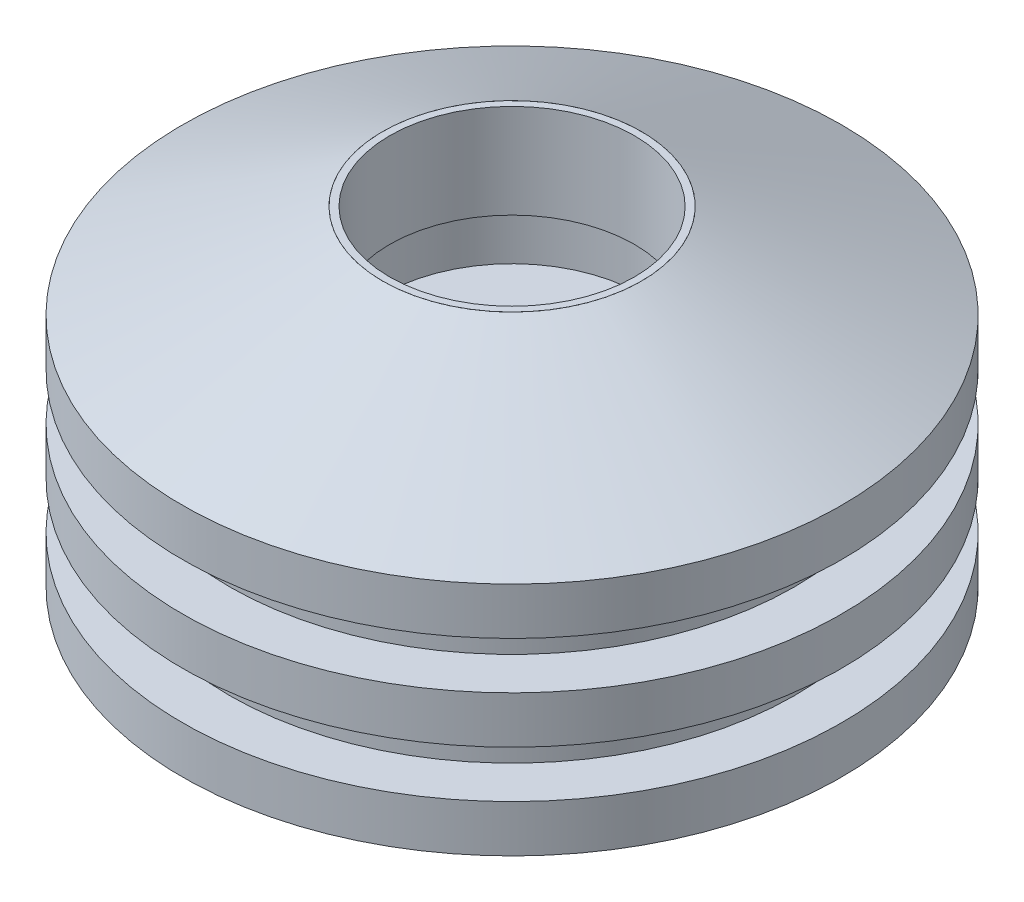
from build123d import *

# Parameters (mm, degrees)
BOSS_EXTRUDE1_START             = 3.175
SKETCH2_R                       = 22.225
SKETCH2_R_2                     = 8.73125
BOSS_EXTRUDE1_DEPTH             = 3.175
SKETCH3_R                       = 19.05
BOSS_EXTRUDE2_DEPTH             = 3.175
BOSS_EXTRUDE3_START             = 3.175
SKETCH4_R                       = 22.225
BOSS_EXTRUDE3_DEPTH             = 3.175
SKETCH5_R                       = 19.05
BOSS_EXTRUDE4_DEPTH             = 3.175
BOSS_EXTRUDE5_START             = 3.175
SKETCH6_R                       = 22.225
BOSS_EXTRUDE5_DEPTH             = 3.175
SKETCH7_R                       = 8.73125
BOSS_EXTRUDE6_DEPTH             = 6.35
SKETCH10_R                      = 8.255
CUT_EXTRUDE1_DEPTH              = 9.525
F_1_4_28_START                  = -15.875
F_1_4_28_TAPPED_HOLE1_OUTLINE_R = 2.7051
F_1_4_28_TAPPED_HOLE1_DEPTH     = 12.7


# Read off the part's stored shape, not the designer's step: 1/4-28 Tapped Hole1
with BuildPart() as part:
    # Sketch1 → Revolve1 (revolve)
    with BuildSketch(Plane.XY, mode=Mode.PRIVATE) as revolve1_sk:
        Polygon((8.73125, 0), (22.225, 0), (8.73125, 6.35), align=None)
    revolve(revolve1_sk.sketch.rotate(Axis((0, 0, 0), (0, 1, 0)), 90), axis=Axis((0, 0, 0), (0, 1, 0)))

    # Sketch2 → Boss-Extrude1 (add)
    with BuildSketch(Plane.XZ.offset(BOSS_EXTRUDE1_START)):
        with Locations(Location((0, 0, 0), (0, 0, 270))):
            Circle(SKETCH2_R)
        with Locations(Location((0, 0, 0), (0, 0, 270))):
            Circle(SKETCH2_R_2, mode=Mode.SUBTRACT)
    extrude(amount=-BOSS_EXTRUDE1_DEPTH)

    # Sketch3 → Boss-Extrude2 (add)
    with BuildSketch(Plane.XZ.offset(3.175)):
        with Locations(Location((0, 0, 0), (0, 0, 270))):
            Circle(SKETCH3_R)
    extrude(amount=BOSS_EXTRUDE2_DEPTH)

    # Sketch4 → Boss-Extrude3 (add)
    with BuildSketch(Plane.XZ.offset(6.35).offset(BOSS_EXTRUDE3_START)):
        with Locations(Location((0, 0, 0), (0, 0, 270))):
            Circle(SKETCH4_R)
    extrude(amount=-BOSS_EXTRUDE3_DEPTH)

    # Sketch5 → Boss-Extrude4 (add)
    with BuildSketch(Plane.XZ.offset(9.525)):
        with Locations(Location((0, 0, 0), (0, 0, 270))):
            Circle(SKETCH5_R)
    extrude(amount=BOSS_EXTRUDE4_DEPTH)

    # Sketch6 → Boss-Extrude5 (add)
    with BuildSketch(Plane.XZ.offset(12.7).offset(BOSS_EXTRUDE5_START)):
        with Locations(Location((0, 0, 0), (0, 0, 270))):
            Circle(SKETCH6_R)
    extrude(amount=-BOSS_EXTRUDE5_DEPTH)

    # 1/4-28 Tapped Hole1 outline → 1/4-28 Tapped Hole1 (cut)
    with BuildSketch(Plane(origin=(0, 0, 0), x_dir=(1, 0, 0), z_dir=(0, 1, 0)).offset(F_1_4_28_START)):
        Circle(F_1_4_28_TAPPED_HOLE1_OUTLINE_R)
    extrude(amount=F_1_4_28_TAPPED_HOLE1_DEPTH, mode=Mode.SUBTRACT)


with BuildPart() as body_2:
    # Sketch7 → Boss-Extrude6 (new body)
    with BuildSketch(Plane(origin=(0, 6.35, 0), x_dir=(1, 0, 0), z_dir=(0, 1, 0))):
        with Locations(Location((0, 0, 0), (0, 0, 270))):
            Circle(SKETCH7_R)
    extrude(amount=-BOSS_EXTRUDE6_DEPTH)

    # Sketch10 → Cut-Extrude1 (cut)
    with BuildSketch(Plane(origin=(0, 6.35, 0), x_dir=(1, 0, 0), z_dir=(0, 1, 0))):
        with Locations(Location((0, 0, 0), (0, 0, 270))):
            Circle(SKETCH10_R)
    extrude(amount=-CUT_EXTRUDE1_DEPTH, mode=Mode.SUBTRACT)


solid = Compound([part.part, body_2.part])
